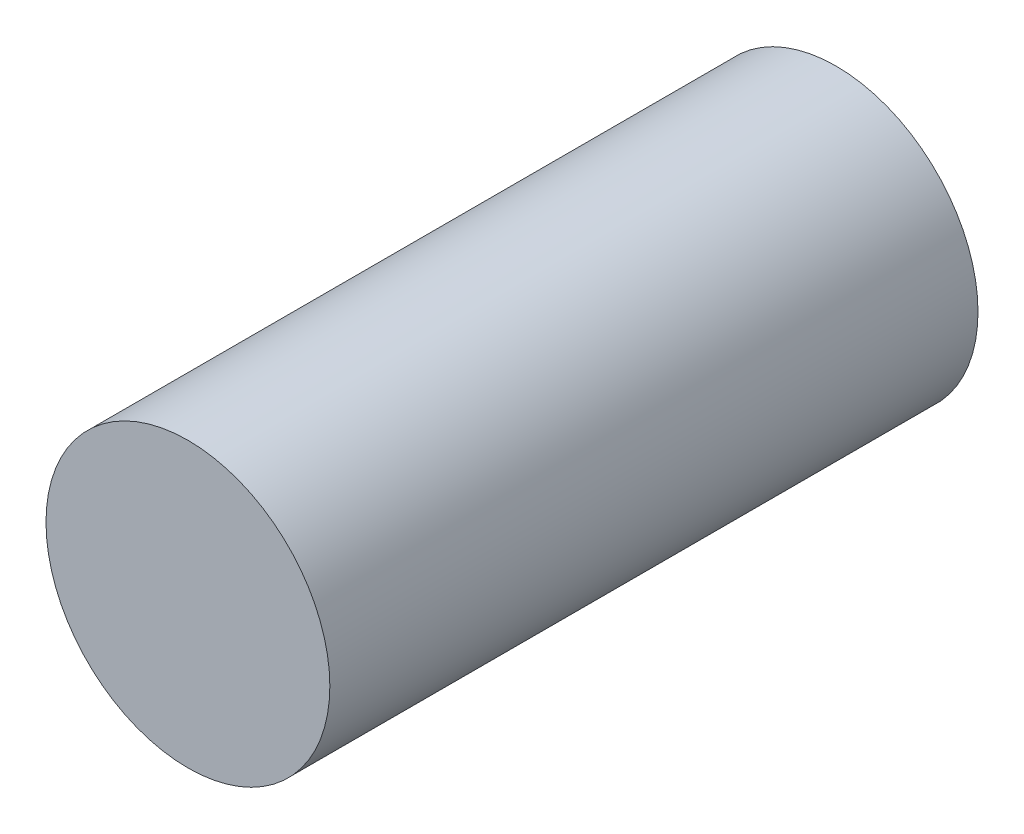
from build123d import *

# Parameters (mm, degrees)
SKETCH1_R           = 6.35
BOSS_EXTRUDE1_DEPTH = 29


with BuildPart() as part:
    # Sketch1 → Boss-Extrude1 (new body)
    with BuildSketch(Plane.XY):
        Circle(SKETCH1_R)
    extrude(amount=BOSS_EXTRUDE1_DEPTH)


solid = part.part
